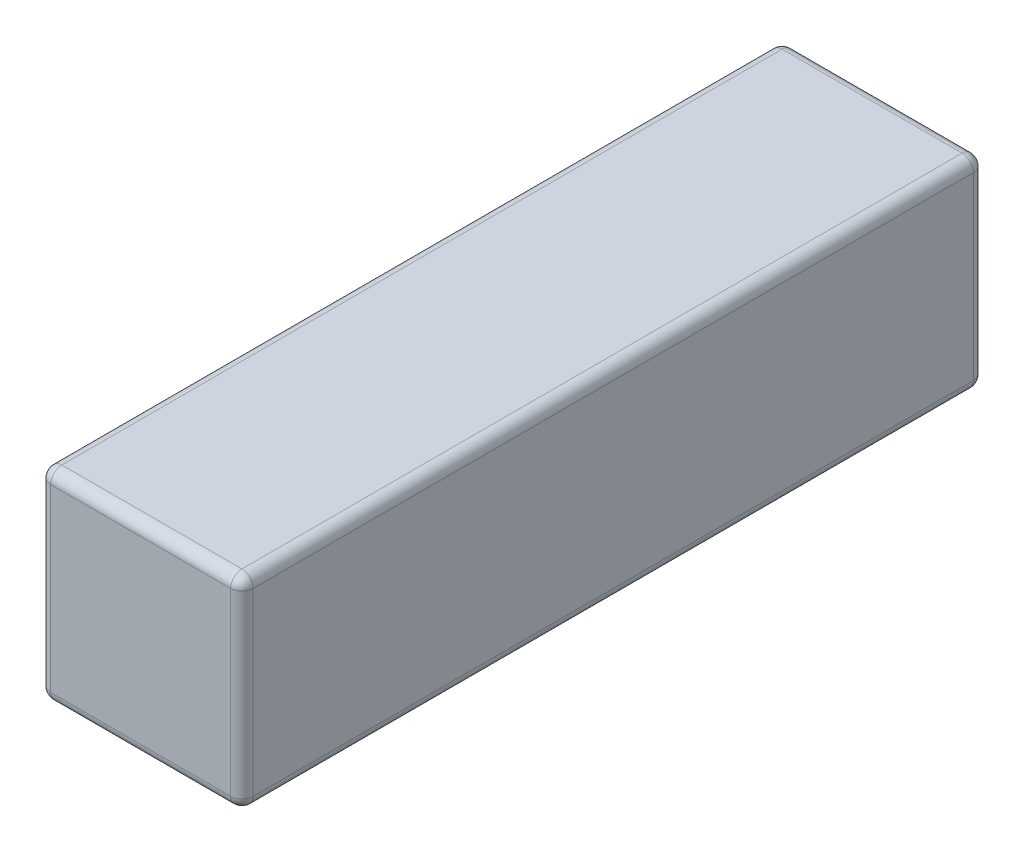
from build123d import *

# Parameters (mm, degrees)
SKETCH1_W           = 9
SKETCH1_H           = 9
BOSS_EXTRUDE1_DEPTH = 33
FILLET1_R           = 0.5


with BuildPart() as part:
    # Sketch1 → Boss-Extrude1 (new body)
    with BuildSketch(Plane.XY):
        Rectangle(SKETCH1_W, SKETCH1_H)
    extrude(amount=BOSS_EXTRUDE1_DEPTH)

    # Fillet1
    fillet1_edges = [part.edges().sort_by_distance(p)[0] for p in [
        (-4.5, 4.5, 16.5),
        (-4.5, -4.5, 16.5),
        (4.5, -4.5, 16.5),
        (4.5, 4.5, 16.5),
        (0, 4.5, 0),
        (4.5, 0, 0),
        (0, -4.5, 0),
        (-4.5, 0, 0),
        (-4.5, 0, 33),
        (0, -4.5, 33),
        (4.5, 0, 33),
        (0, 4.5, 33),
    ]]
    fillet(fillet1_edges, radius=FILLET1_R)


solid = part.part
